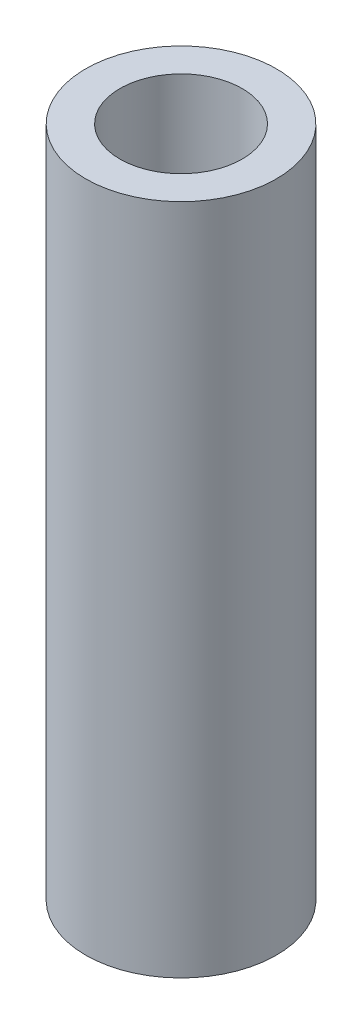
from build123d import *

# Parameters (mm, degrees)
SKETCH1_R           = 27.875
SKETCH1_R_2         = 17.875
BOSS_EXTRUDE1_DEPTH = 196.5
SKETCH2_R           = 11.53
CUT_EXTRUDE1_DEPTH  = 201.415271998


with BuildPart() as part:
    # Sketch1 → Boss-Extrude1 (new body)
    with BuildSketch(Plane(origin=(0, 0, 0), x_dir=(1, 0, 0), z_dir=(0, 1, 0))):
        Circle(SKETCH1_R)
        Circle(SKETCH1_R_2, mode=Mode.SUBTRACT)
    extrude(amount=BOSS_EXTRUDE1_DEPTH)

    # Sketch2 → Cut-Extrude1 (cut, through all)
    with BuildSketch(Plane(origin=(0, 0, 0), x_dir=(0, 0, -1), z_dir=(1, 0, 0))):
        with Locations((0, 131.8)):
            Circle(SKETCH2_R)
        with Locations((0, 80.8)):
            Circle(SKETCH2_R)
        with Locations((0, 29.8)):
            Circle(SKETCH2_R)
    extrude(amount=-CUT_EXTRUDE1_DEPTH, mode=Mode.SUBTRACT)


solid = part.part
